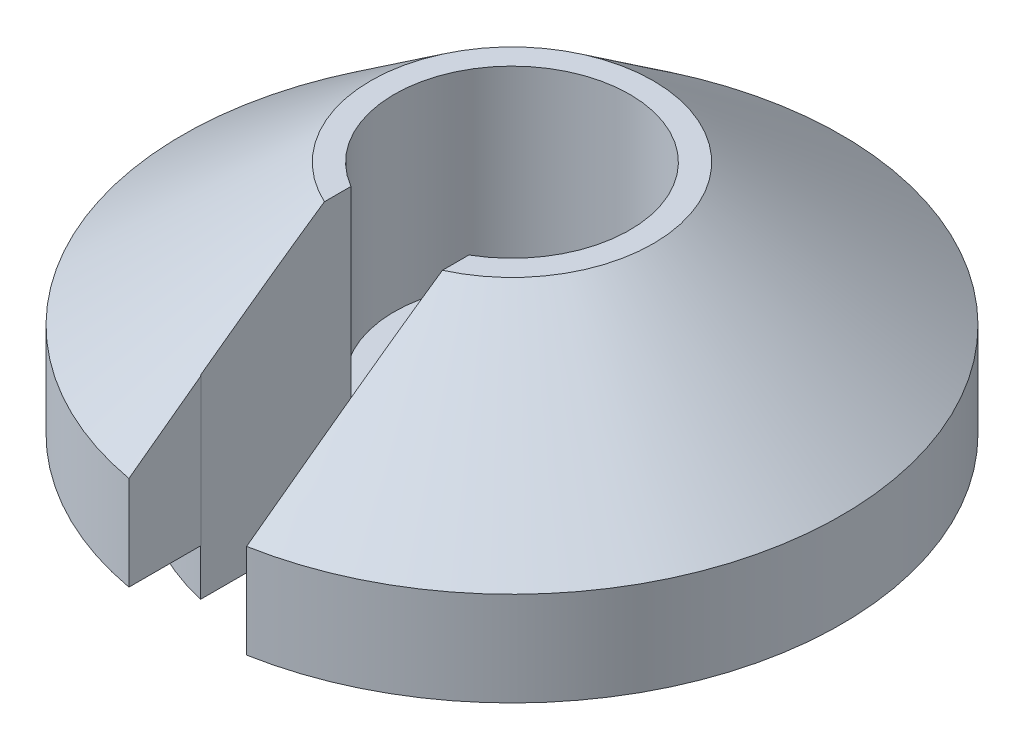
from build123d import *

# Parameters (mm, degrees)
SKETCH7_R               = 2.5
CUT_EXTRUDE2_DEPTH      = 4
CUT_EXTRUDE3_DEPTH      = 4
CUT_EXTRUDE3_DEPTH_BACK = 4
SKETCH8_W               = 2.5
SKETCH8_H               = 7.259020633
FILLET1_R               = 1.5
SKETCH9_W               = 2.5
SKETCH9_H               = 5.356071321
CUT_EXTRUDE4_DEPTH      = 10
FILLET2_R               = 1.25
SKETCH10_W              = 2.503236591
SKETCH10_H              = 5.356071321
CUT_EXTRUDE5_DEPTH      = 10
SKETCH11_W              = 2.503236591
SKETCH11_H              = 6.001405943
CUT_EXTRUDE6_DEPTH      = 10
FILLET4_R               = 1.25
SKETCH12_W              = 2.514787158
SKETCH12_H              = 5.75
CUT_EXTRUDE9_DEPTH      = 10
SKETCH14_R              = 1.249039751
CUT_EXTRUDE10_DEPTH     = 10


# Some blends are built 0.0001 mm under size
with BuildPart() as part:
    # Sketch5 → Revolve3 (revolve)
    with BuildSketch(Plane.XY, mode=Mode.PRIVATE) as revolve3_sk:
        Polygon((0, 0), (5.5, 0), (5.5, 1), (7, 1), (7, 3), (3, 6), (0, 6), align=None)
    revolve(revolve3_sk.sketch.rotate(Axis((0, 6, 0), (0, -1, 0)), 180), axis=Axis((0, 6, 0), (0, -1, 0)))

    # Sketch7 → Cut-Extrude2 (cut)
    with BuildSketch(Plane(origin=(0, 6, 0), x_dir=(1, 0, 0), z_dir=(0, 1, 0))):
        with Locations(Location((0, 0, 0), (0, 0, 180))):
            Circle(SKETCH7_R)
    extrude(amount=-CUT_EXTRUDE2_DEPTH, mode=Mode.SUBTRACT)

    # Sketch8 → Cut-Extrude3 (cut, two sides: drawn at the far end of the back side and taken through both)
    with BuildSketch(Plane(origin=(0, 2, 0), x_dir=(1, 0, 0), z_dir=(0, 1, 0)).offset(-CUT_EXTRUDE3_DEPTH_BACK)):
        with Locations((0, -3.629510317)):
            Rectangle(SKETCH8_W, SKETCH8_H)
    extrude(amount=CUT_EXTRUDE3_DEPTH + CUT_EXTRUDE3_DEPTH_BACK, mode=Mode.SUBTRACT)

    # Fillet1
    # the kernel refuses this fillet: 1.5 mm, written as the material it adds along each edge
    with BuildSketch(Plane(origin=(1.25, 2, 0), x_dir=(-1, 0, 0), z_dir=(0, -1, 0)), Plane(origin=(-1.25, 0, 0), x_dir=(1, 0, 0), z_dir=(0, 1, 0))) as fillet1_piece_1:
        with BuildLine():
            CenterArc((FILLET1_R, -FILLET1_R), FILLET1_R, 90, 90)
            Line((0, -FILLET1_R), (0, 0))
            Line((0, 0), (FILLET1_R, 0))
        make_face()
    extrude(amount=2)

    # Sketch9 → Cut-Extrude4 (cut)
    with BuildSketch(Plane(origin=(0, 0, 0), x_dir=(-1, 0, 0), z_dir=(0, -1, 0))):
        with Locations((0, -2.67803566)):
            Rectangle(SKETCH9_W, SKETCH9_H)
    extrude(amount=-CUT_EXTRUDE4_DEPTH, mode=Mode.SUBTRACT)

    # Fillet2
    fillet2_edges = [part.edges().sort_by_distance(p)[0] for p in [
        (-1.25, 1, 0),
        (1.25, 1, 0),
    ]]
    fillet(fillet2_edges, radius=FILLET2_R - 0.0001)  # a hair under: the kernel refuses the full size

    # Sketch10 → Cut-Extrude5 (cut)
    with BuildSketch(Plane.XZ):
        with Locations((-0.001618296, 2.67803566)):
            Rectangle(SKETCH10_W, SKETCH10_H)
    extrude(amount=-CUT_EXTRUDE5_DEPTH, mode=Mode.SUBTRACT)

    # Sketch11 → Cut-Extrude6 (cut)
    with BuildSketch(Plane(origin=(0, 0, 0), x_dir=(-1, 0, 0), z_dir=(0, -1, 0))):
        with Locations((0.001618296, -2.355368349)):
            Rectangle(SKETCH11_W, SKETCH11_H)
    extrude(amount=-CUT_EXTRUDE6_DEPTH, mode=Mode.SUBTRACT)

    # Fillet4
    fillet4_edges = [part.edges().sort_by_distance(p)[0] for p in [
        (1.25, 1, -0.645334622),
        (-1.253236591, 1, -0.645334622),
    ]]
    fillet(fillet4_edges, radius=FILLET4_R)

    # Sketch12 → Cut-Extrude9 (cut)
    with BuildSketch(Plane.XZ):
        with Locations((-0.007393579, 2.481071321)):
            Rectangle(SKETCH12_W, SKETCH12_H)
    extrude(amount=-CUT_EXTRUDE9_DEPTH, mode=Mode.SUBTRACT)

    # Sketch14 → Cut-Extrude10 (cut)
    with BuildSketch(Plane(origin=(0, 0, 0), x_dir=(-1, 0, 0), z_dir=(0, -1, 0))):
        with Locations((0.007393579, 0.393928679)):
            Circle(SKETCH14_R)
    extrude(amount=-CUT_EXTRUDE10_DEPTH, mode=Mode.SUBTRACT)


solid = part.part
